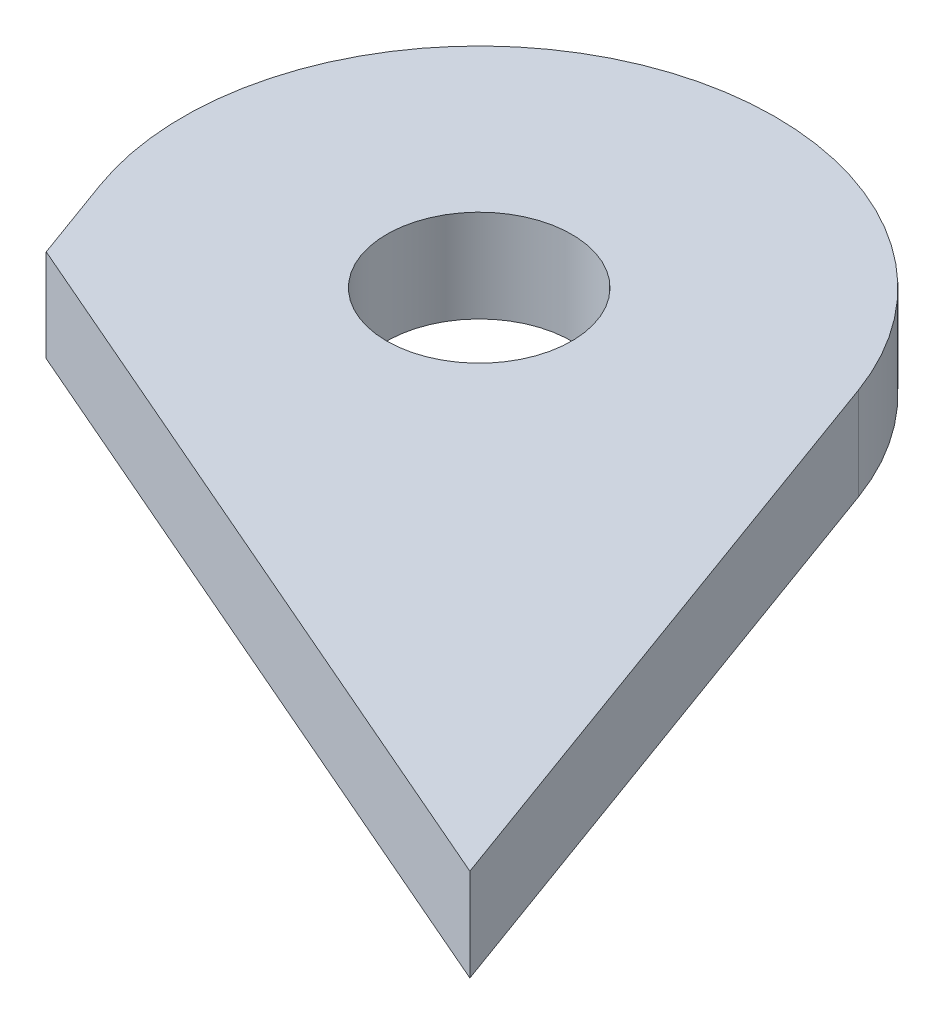
from build123d import *

# Parameters (mm, degrees)
SKETCH1_R           = 6.35
BOSS_EXTRUDE1_DEPTH = 6.35


with BuildPart() as part:
    # Sketch1 → Boss-Extrude1 (new body)
    with BuildSketch(Plane(origin=(0, 0, 0), x_dir=(1, 0, 0), z_dir=(0, 1, 0))):
        with BuildLine():
            Line((19.094554054, 6.949849312), (34.365509447, -35.006755803))
            Line((34.365509447, -35.006755803), (-16.990886166, -12.729629333))
            Line((-16.990886166, -12.729629333), (-19.094554054, -6.949849312))
            ThreePointArc((-19.094554054, -6.949849312), (-6.949849312, 19.094554054), (19.094554054, 6.949849312))
        make_face()
        Circle(SKETCH1_R, mode=Mode.SUBTRACT)
    extrude(amount=BOSS_EXTRUDE1_DEPTH)


solid = part.part
